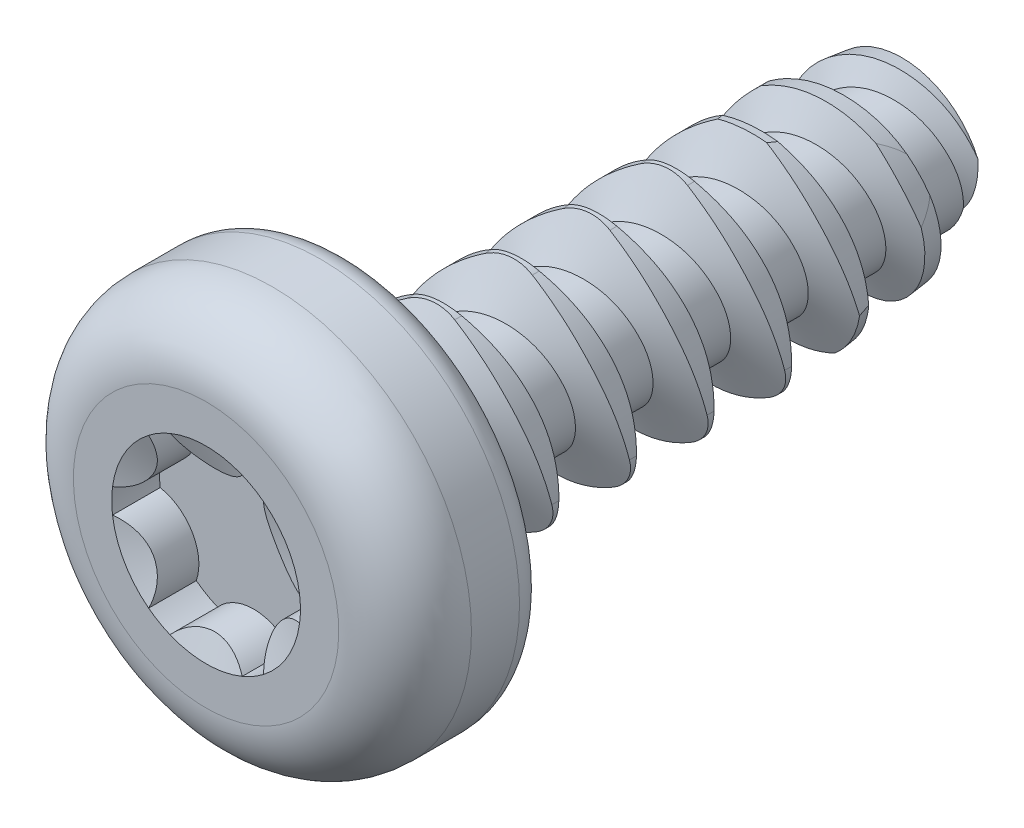
from build123d import *

# Parameters (mm, degrees)
SKETCH1_R          = 3.429
EXTRUDE3_DEPTH     = 2.4638
CUT_EXTRUDE1_DEPTH = 0.821266667
CUT_SWEEP1_PITCH   = 1.336842105
CUT_SWEEP1_TO      = 9.525
SKETCH18_OUTSIDE_W = 11.942
SKETCH18_OUTSIDE_H = 11.942
CUT_EXTRUDE3_DEPTH = 11.688391379


with BuildPart() as part:
    # Sketch17 → Revolve1 (revolve)
    with BuildSketch(Plane(origin=(0, 0, 0), x_dir=(0, 0, -1), z_dir=(1, 0, 0))):
        Polygon((0, 0), (9.525, 0), (9.525, 1.424612871), (8.42772, 1.559341914), (7.33044, 1.694070957), (6.23316, 1.8288), (0, 1.8288), align=None)
    revolve(axis=Axis((0, 0, 0), (0, 0, 1)))

    # Sketch1 → Extrude3 (add)
    with BuildSketch(Plane.XY):
        Circle(SKETCH1_R)
    extrude(amount=EXTRUDE3_DEPTH)

    # Sketch11 → Cut-Revolve3 (revolve, cut)
    with BuildSketch(Plane(origin=(0, 0, 0), x_dir=(0, 0, -1), z_dir=(1, 0, 0))):
        with BuildLine():
            Line((-1.3208, 3.429), (-0.49276, 3.429))
            ThreePointArc((-0.49276, 3.429), (-0.144326063, 3.284673937), (0, 2.93624))
            Line((0, 2.93624), (0.254, 2.93624))
            Line((0.254, 2.93624), (0.254, 3.683))
            Line((0.254, 3.683), (-2.7178, 3.683))
            Line((-2.7178, 3.683), (-2.7178, 2.286))
            Line((-2.7178, 2.286), (-2.4638, 2.286))
            ThreePointArc((-2.4638, 2.286), (-2.129023051, 3.094223051), (-1.3208, 3.429))
        make_face()
    revolve(axis=Axis((0, 0, 0), (0, 0, 1)), mode=Mode.SUBTRACT)

    # Sketch12 → Cut-Extrude1 (cut)
    with BuildSketch(Plane.XY.offset(2.4638)):
        with BuildLine():
            ThreePointArc((0.8128, 1.407810896), (0.718984495, 1.457956329), (0.622090188, 1.501858568))
            ThreePointArc((0.622090188, 1.501858568), (0, 1.2192), (-0.622090188, 1.501858568))
            ThreePointArc((-0.622090188, 1.501858568), (-0.718984495, 1.457956329), (-0.8128, 1.407810896))
            ThreePointArc((-0.8128, 1.407810896), (-0.903134971, 1.351637002), (-0.989602579, 1.28967519))
            ThreePointArc((-0.989602579, 1.28967519), (-1.055858172, 0.6096), (-1.611692767, 0.212183378))
            ThreePointArc((-1.611692767, 0.212183378), (-1.622119466, 0.106319327), (-1.6256, 0))
            ThreePointArc((-1.6256, 0), (-1.622119466, -0.106319327), (-1.611692767, -0.212183378))
            ThreePointArc((-1.611692767, -0.212183378), (-1.055858172, -0.6096), (-0.989602579, -1.28967519))
            ThreePointArc((-0.989602579, -1.28967519), (-0.903134971, -1.351637002), (-0.8128, -1.407810896))
            ThreePointArc((-0.8128, -1.407810896), (-0.718984495, -1.457956329), (-0.622090188, -1.501858568))
            ThreePointArc((-0.622090188, -1.501858568), (0, -1.2192), (0.622090188, -1.501858568))
            ThreePointArc((0.622090188, -1.501858568), (0.718984495, -1.457956329), (0.8128, -1.407810896))
            ThreePointArc((0.8128, -1.407810896), (0.903134971, -1.351637002), (0.989602579, -1.28967519))
            ThreePointArc((0.989602579, -1.28967519), (1.055858172, -0.6096), (1.611692767, -0.212183378))
            ThreePointArc((1.611692767, -0.212183378), (1.622119466, -0.106319327), (1.6256, 0))
            ThreePointArc((1.6256, 0), (1.622119466, 0.106319327), (1.611692767, 0.212183378))
            ThreePointArc((1.611692767, 0.212183378), (1.055858172, 0.6096), (0.989602579, 1.28967519))
            ThreePointArc((0.989602579, 1.28967519), (0.903134971, 1.351637002), (0.8128, 1.407810896))
        make_face()
    extrude(amount=-CUT_EXTRUDE1_DEPTH, mode=Mode.SUBTRACT)

    # Cut-Extrude7 cone 1 section (through the dimple's axis) → Cut-Extrude7 (revolve, cut)
    with BuildSketch(Plane(origin=(0, 0, 2.4638), x_dir=(0, -1, 0), z_dir=(1, 0, 0))):
        Polygon((0, 0), (1.6256, 0), (0, 0.591670013), align=None)
    revolve(axis=Axis((0, 0, 2.4638), (0, 0, -1)), mode=Mode.SUBTRACT)


with BuildPart() as body_2:
    # Split1: the piece on the far side of the plane
    add(part.part)
    split(bisect_by=Plane.XY, keep=Keep.BOTTOM)

    # Cut-Sweep1: arcs per turn and ends read off the stored shape
    # Cut-Sweep1: the profile of Sketch21 profile screwed along a right-hand helix through 9.967978 turns, 8 arcs to a turn; built about Z, then put on its axis
    cut_sweep1_z = Axis((0, 0, 0), (0, 0, 1))
    cut_sweep1_corners = [(1.8291, 0, -1.336708537), (1.8291, 0, -2.606975674), (1.09728, 0, -2.281148417), (1.09728, 0, -1.662535793)]
    with BuildLine(mode=Mode.PRIVATE) as cut_sweep1_profile:
        Line(cut_sweep1_corners[0], cut_sweep1_corners[1])
        Line(cut_sweep1_corners[1], cut_sweep1_corners[2])
        Line(cut_sweep1_corners[2], cut_sweep1_corners[3])
        Line(cut_sweep1_corners[3], cut_sweep1_corners[0])
    cut_sweep1_cap = Face(cut_sweep1_profile.wire())
    cut_sweep1_turn_angles = [0, 22.5, 45, 67.5, 90, 112.5, 135, 157.5, 180, 202.5, 225, 247.5, 270, 292.5, 315, 337.5, 360]
    cut_sweep1_turn_weights = [1, 0.9238795325112867, 1, 0.9238795325112867, 1, 0.9238795325112867, 1, 0.9238795325112867, 1, 0.9238795325112867, 1, 0.9238795325112867, 1, 0.9238795325112867, 1, 0.9238795325112867, 1]
    cut_sweep1_turn_rails = [Edge.make_bspline([Vector(p[0], p[1], 0).rotate(cut_sweep1_z, cut_sweep1_turn_angles[k]) / cut_sweep1_turn_weights[k] + Vector(0, 0, p[2] + CUT_SWEEP1_PITCH * cut_sweep1_turn_angles[k] / 360) for k in range(17)], [0, 0, 0, 1, 1, 2, 2, 3, 3, 4, 4, 5, 5, 6, 6, 7, 7, 8, 8, 8], 2, cut_sweep1_turn_weights) for p in cut_sweep1_corners]
    cut_sweep1_turn_sides = [Face.make_surface_from_curves(cut_sweep1_turn_rails[p[0]], cut_sweep1_turn_rails[p[1]]) for p in [(0, 1), (1, 2), (2, 3), (3, 0)]]
    cut_sweep1_last_angles = [3240, 3262.5, 3285, 3307.5, 3330, 3352.5, 3375, 3397.5, 3420, 3442.5, 3465, 3487.5, 3510, 3532.5, 3555, 3571.736, 3588.472]
    cut_sweep1_last_weights = [1, 0.9238795325112867, 1, 0.9238795325112867, 1, 0.9238795325112867, 1, 0.9238795325112867, 1, 0.9238795325112867, 1, 0.9238795325112867, 1, 0.9238795325112867, 1, 0.957641751851, 1]
    cut_sweep1_last_rails = [Edge.make_bspline([Vector(p[0], p[1], 0).rotate(cut_sweep1_z, cut_sweep1_last_angles[k]) / cut_sweep1_last_weights[k] + Vector(0, 0, p[2] + CUT_SWEEP1_PITCH * cut_sweep1_last_angles[k] / 360) for k in range(17)], [0, 0, 0, 1, 1, 2, 2, 3, 3, 4, 4, 5, 5, 6, 6, 7, 7, 8, 8, 8], 2, cut_sweep1_last_weights) for p in cut_sweep1_corners]
    cut_sweep1_last_sides = [Face.make_surface_from_curves(cut_sweep1_last_rails[p[0]], cut_sweep1_last_rails[p[1]]) for p in [(0, 1), (1, 2), (2, 3), (3, 0)]]
    cut_sweep1 = Plane(origin=(0, 0, -9.525), x_dir=(0, 1, 0), z_dir=(0, 0, 1)) * split(Solid(Shell([*[p.moved(Location((0, 0, CUT_SWEEP1_PITCH * i))) for i in range(9) for p in cut_sweep1_turn_sides], *cut_sweep1_last_sides, cut_sweep1_cap, cut_sweep1_cap.rotate(cut_sweep1_z, 3588.472).moved(Location((0, 0, CUT_SWEEP1_PITCH * 3588.472 / 360)))])), bisect_by=Plane.XY.offset(CUT_SWEEP1_TO), keep=Keep.BOTTOM, mode=Mode.PRIVATE)
    add(cut_sweep1, mode=Mode.SUBTRACT)

    # Sketch18 outside → Cut-Extrude3 (cut, through all)
    with BuildSketch(Plane(origin=(0, 0, 0), x_dir=(-1, 0, 0), z_dir=(0, 0, -1))):
        Rectangle(SKETCH18_OUTSIDE_W, SKETCH18_OUTSIDE_H)
        with BuildLine():
            ThreePointArc((-0.365776666, 1.730785281), (0, 1.8288), (0.365776666, 1.730785281))
            ThreePointArc((0.365776666, 1.730785281), (1.329150946, 0.767385657), (1.681792355, -0.548620756))
            ThreePointArc((1.681792355, -0.548620756), (1.583787258, -0.9144), (1.316015689, -1.182164525))
            ThreePointArc((1.316015689, -1.182164525), (0, -1.534771313), (-1.316015689, -1.182164525))
            ThreePointArc((-1.316015689, -1.182164525), (-1.583787258, -0.9144), (-1.681792355, -0.548620756))
            ThreePointArc((-1.681792355, -0.548620756), (-1.329150946, 0.767385657), (-0.365776666, 1.730785281))
        make_face(mode=Mode.SUBTRACT)
    extrude(amount=CUT_EXTRUDE3_DEPTH, mode=Mode.SUBTRACT)


with BuildPart() as part_1:
    add(part.part)

    # Split1
    split(bisect_by=Plane.XY, keep=Keep.TOP)

    # Combine1: union body 2
    add(body_2.part)


solid = part_1.part
